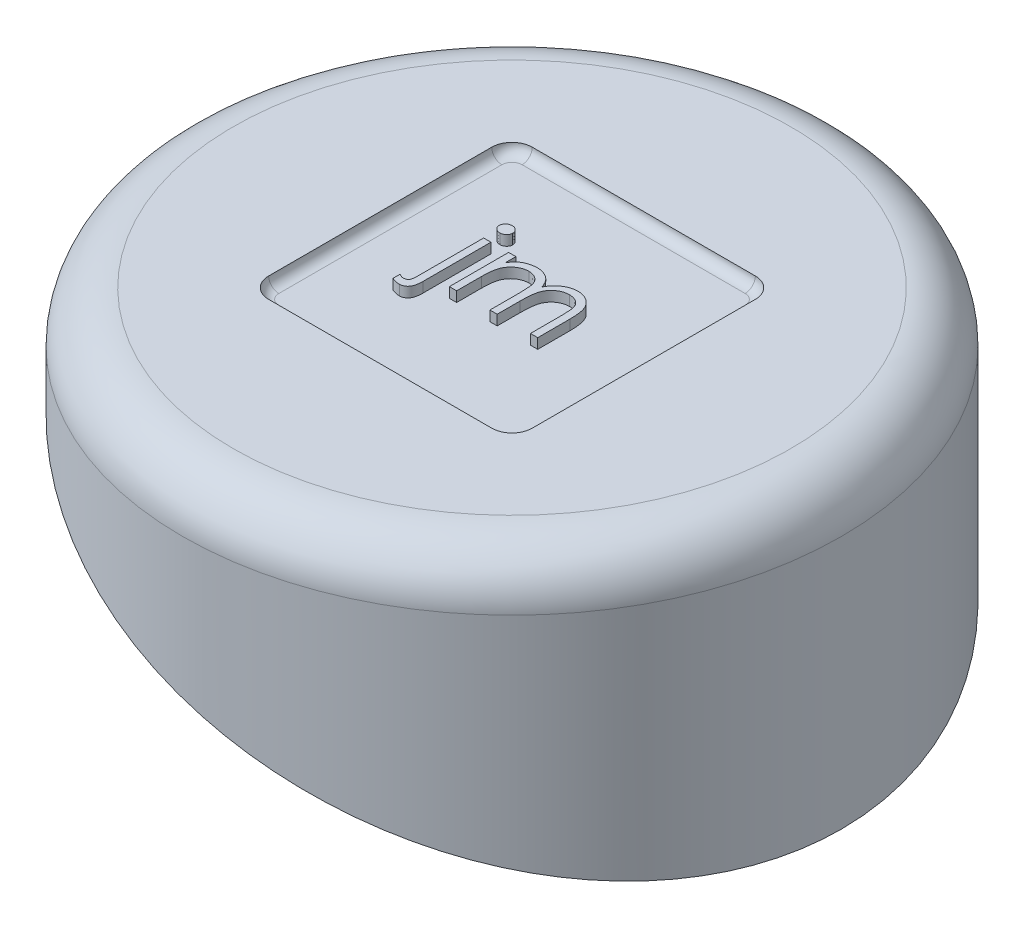
from build123d import *

# Parameters (mm, degrees)
SKETCH1_R                      = 32.5
BOSS_EXTRUDE1_DEPTH            = 30
CUT_EXTRUDE1_REACH             = 56.886
CUT_EXTRUDE1_DIRECTION_2_REACH = 56.886
FILLET1_R                      = 5
CUT_EXTRUDE2_DEPTH             = 1
FILLET3_R                      = 1


# Read off the part's stored shape, not the designer's step: Shell1
with BuildPart() as part:
    # Sketch1 → Boss-Extrude1 (new body)
    with BuildSketch(Plane(origin=(0, 0, 0), x_dir=(1, 0, 0), z_dir=(0, 1, 0))):
        with Locations(Location((0, 0, 0), (0, 0, 270))):
            Circle(SKETCH1_R)
    extrude(amount=BOSS_EXTRUDE1_DEPTH)

    # Sketch2 → Cut-Extrude1 (cut, up to next)
    with BuildSketch(Plane.XY, mode=Mode.PRIVATE) as cut_extrude1_sk1:
        Polygon((32.5, 0), (-32.5, 0), (-32.5, 22.381294864), align=None)
    cut_extrude1_tool1 = extrude(cut_extrude1_sk1.sketch, amount=-CUT_EXTRUDE1_REACH, mode=Mode.PRIVATE) & part.part
    add(cut_extrude1_tool1.solids().sort_by_distance((-10.833333, 7.460432, 0))[0], mode=Mode.SUBTRACT)

    # Sketch2 → Cut-Extrude1 direction 2 (cut, up to next)
    with BuildSketch(Plane.XY, mode=Mode.PRIVATE) as cut_extrude1_direction_2_sk1:
        Polygon((32.5, 0), (-32.5, 0), (-32.5, 22.381294864), align=None)
    cut_extrude1_direction_2_tool1 = extrude(cut_extrude1_direction_2_sk1.sketch, amount=CUT_EXTRUDE1_DIRECTION_2_REACH, mode=Mode.PRIVATE) & part.part
    add(cut_extrude1_direction_2_tool1.solids().sort_by_distance((-10.833333, 7.460432, 0))[0], mode=Mode.SUBTRACT)

    # Fillet1
    fillet1_edges = [part.edges().sort_by_distance(p)[0] for p in [
        (0, 30, -32.5),
    ]]
    fillet(fillet1_edges, radius=FILLET1_R)

    # Shell1 outline → Shell1 (revolve, cut)
    with BuildSketch(Plane.XY):
        with BuildLine():
            Line((30, 0.855474381), (30, 25))
            ThreePointArc((30, 25), (29.267766953, 26.767766953), (27.5, 27.5))
            Line((27.5, 27.5), (0, 27.5))
            Line((0, 27.5), (0, 0.855474381))
            Line((0, 0.855474381), (30, 0.855474381))
        make_face()
    revolve(axis=Axis((0, 0, 0), (0, 1, 0)), mode=Mode.SUBTRACT)

    # Sketch3 → Cut-Extrude2 (cut)
    with BuildSketch(Plane(origin=(0, 30, 0), x_dir=(1, 0, 0), z_dir=(0, 1, 0))):
        with BuildLine():
            Line((-11, -13), (11, -13))
            ThreePointArc((11, -13), (12.414213562, -12.414213562), (13, -11))
            Line((13, -11), (13, 11))
            ThreePointArc((13, 11), (12.414213562, 12.414213562), (11, 13))
            Line((11, 13), (-11, 13))
            ThreePointArc((-11, 13), (-12.414213562, 12.414213562), (-13, 11))
            Line((-13, 11), (-13, -11))
            ThreePointArc((-13, -11), (-12.414213562, -12.414213562), (-11, -13))
        make_face()
        with BuildLine():
            add(Edge.make_bspline(
                [(-5.282051282, 5.307692308), (-5.236975366, 5.305640925), (-5.149218681, 5.301647161), (-5.022802533, 5.267338194), (-4.909061876, 5.207587837), (-4.807209142, 5.129974539), (-4.721777304, 5.036046271), (-4.659757623, 4.929046076), (-4.623067759, 4.811615461), (-4.617980131, 4.730489807), (-4.615384615, 4.689102564)],
                knots=[0, 0, 0, 0, 1.06928763, 2.081757757, 3.080304056, 4.102817284, 5.108909582, 6.075019406, 7.017947647, 8, 8, 8, 8], degree=3))
            add(Edge.make_bspline(
                [(-4.615384615, 4.689102564), (-4.618030629, 4.648790576), (-4.623250749, 4.569262093), (-4.659730308, 4.453851407), (-4.722295343, 4.348351335), (-4.807151947, 4.254605589), (-4.90907689, 4.177036802), (-5.022798515, 4.117274713), (-5.149219758, 4.082968888), (-5.236975731, 4.078974685), (-5.282051282, 4.076923077)],
                knots=[0, 0, 0, 0, 0.962634111, 1.899108286, 2.860048811, 3.872254101, 4.900980094, 5.905593535, 6.924215405, 8, 8, 8, 8], degree=3))
            add(Edge.make_bspline(
                [(-5.282051282, 4.076923077), (-5.327126833, 4.078974685), (-5.414882807, 4.082968888), (-5.541304049, 4.117274713), (-5.655025674, 4.177036802), (-5.756950617, 4.254605589), (-5.841807221, 4.348351335), (-5.904372256, 4.453851407), (-5.940851815, 4.569262093), (-5.946071935, 4.648790576), (-5.948717949, 4.689102564)],
                knots=[0, 0, 0, 0, 1.075784595, 2.094406465, 3.099019906, 4.127745899, 5.139951189, 6.100891714, 7.037365889, 8, 8, 8, 8], degree=3))
            add(Edge.make_bspline(
                [(-5.948717949, 4.689102564), (-5.946122433, 4.730489807), (-5.941034805, 4.811615461), (-5.904344941, 4.929046076), (-5.84232526, 5.036046271), (-5.756893422, 5.129974539), (-5.655040688, 5.207587837), (-5.541300031, 5.267338194), (-5.414883883, 5.301647161), (-5.327127198, 5.305640925), (-5.282051282, 5.307692308)],
                knots=[0, 0, 0, 0, 0.982052353, 1.924980594, 2.891090418, 3.897182716, 4.919695944, 5.918242243, 6.93071237, 8, 8, 8, 8], degree=3))
        make_face(mode=Mode.SUBTRACT)
        with BuildLine():
            Line((-5.641025641, 2.846153846), (-4.923076923, 2.846153846))
            Line((-4.923076923, 2.846153846), (-4.923076923, -3.854166667))
            add(Edge.make_bspline(
                [(-4.923076923, -3.854166667), (-4.923306085, -3.9134959), (-4.92374644, -4.027502442), (-4.937853634, -4.192129944), (-4.956153699, -4.344763739), (-4.982838189, -4.485226726), (-5.018144966, -4.613403668), (-5.061487106, -4.728474639), (-5.110239651, -4.832873999), (-5.170616622, -4.922792881), (-5.236266238, -5.001707505), (-5.307762498, -5.069990372), (-5.38471384, -5.128500979), (-5.468928137, -5.17443688), (-5.557665381, -5.212539031), (-5.652827641, -5.237094733), (-5.753111759, -5.254357849), (-5.822036034, -5.255714655), (-5.857371795, -5.256410256)],
                knots=[0, 0, 0, 0, 1.493029139, 2.868991889, 4.156754484, 5.362105958, 6.464967428, 7.499106053, 8.455465818, 9.358121702, 10.217355437, 11.035397588, 11.842309395, 12.643033568, 13.444773531, 14.266895717, 15.11148054, 16, 16, 16, 16], degree=3))
            add(Edge.make_bspline(
                [(-5.857371795, -5.256410256), (-5.919503866, -5.25426354), (-6.047915131, -5.249826819), (-6.245119458, -5.211028318), (-6.453856567, -5.154014571), (-6.59390963, -5.100115663), (-6.666666667, -5.072115385)],
                knots=[0, 0, 0, 0, 0.892368802, 1.844300437, 2.88012224, 4, 4, 4, 4], degree=3))
            Line((-6.666666667, -5.072115385), (-6.666666667, -4.381410256))
            add(Edge.make_bspline(
                [(-6.666666667, -4.381410256), (-6.621269973, -4.405620615), (-6.534648133, -4.45181662), (-6.402078767, -4.498579162), (-6.277898955, -4.532843954), (-6.196252149, -4.536639293), (-6.157051282, -4.538461538)],
                knots=[0, 0, 0, 0, 1.144578483, 2.183980519, 3.128079311, 4, 4, 4, 4], degree=3))
            add(Edge.make_bspline(
                [(-6.157051282, -4.538461538), (-6.111728271, -4.535550781), (-6.024320372, -4.529937226), (-5.902440887, -4.481495192), (-5.799697424, -4.399275874), (-5.752282332, -4.325381348), (-5.727564103, -4.286858974)],
                knots=[0, 0, 0, 0, 1.036054724, 1.998088038, 2.956371939, 4, 4, 4, 4], degree=3))
            add(Edge.make_bspline(
                [(-5.727564103, -4.286858974), (-5.713528983, -4.253032533), (-5.680686851, -4.173878778), (-5.658252882, -4.025781528), (-5.642515867, -3.837488752), (-5.641553677, -3.697187626), (-5.641025641, -3.620192308)],
                knots=[0, 0, 0, 0, 0.647276487, 1.514624746, 2.636060416, 4, 4, 4, 4], degree=3))
            Line((-5.641025641, -3.620192308), (-5.641025641, 2.846153846))
        make_face(mode=Mode.SUBTRACT)
        with BuildLine():
            Line((-3.179487179, 2.846153846), (-2.461538462, 2.846153846))
            Line((-2.461538462, 2.846153846), (-2.461538462, 1.830128205))
            add(Edge.make_bspline(
                [(-2.461538462, 1.830128205), (-2.396889433, 1.919014152), (-2.273015697, 2.089328148), (-2.069894205, 2.313763083), (-1.866977377, 2.504227436), (-1.720843933, 2.604211143), (-1.650641026, 2.65224359)],
                knots=[0, 0, 0, 0, 1.134379233, 2.173579362, 3.122582517, 4, 4, 4, 4], degree=3))
            add(Edge.make_bspline(
                [(-1.650641026, 2.65224359), (-1.554950369, 2.697970139), (-1.365240884, 2.788624341), (-1.064854084, 2.880586761), (-0.757483411, 2.937101279), (-0.549921779, 2.944830132), (-0.445512821, 2.948717949)],
                knots=[0, 0, 0, 0, 1.014936303, 2.012140481, 3.000054389, 4, 4, 4, 4], degree=3))
            add(Edge.make_bspline(
                [(-0.445512821, 2.948717949), (-0.374900257, 2.946328713), (-0.235161791, 2.941600543), (-0.028112442, 2.910834748), (0.172707242, 2.857654924), (0.366110738, 2.783581041), (0.548329434, 2.693874328), (0.715390457, 2.588617853), (0.865388647, 2.470453109), (0.998248193, 2.334044119), (1.117720251, 2.175560465), (1.227614758, 1.990727897), (1.3291581, 1.7753961), (1.385435377, 1.61912972), (1.415064103, 1.536858974)],
                knots=[0, 0, 0, 0, 1.009824226, 1.998387844, 2.986035974, 3.974953746, 4.955485308, 5.885931332, 6.793869504, 7.679848016, 8.601185859, 9.625726857, 10.749998409, 12, 12, 12, 12], degree=3))
            add(Edge.make_bspline(
                [(1.415064103, 1.536858974), (1.446404106, 1.593371933), (1.508076831, 1.704581498), (1.611632572, 1.861971812), (1.720130393, 2.009187336), (1.834494948, 2.146344878), (1.954322576, 2.272767119), (2.080177205, 2.388872037), (2.211342419, 2.495158239), (2.393724682, 2.619325461), (2.631010642, 2.751213876), (2.930183475, 2.865564605), (3.241383868, 2.936230041), (3.452624321, 2.944527808), (3.559294872, 2.948717949)],
                knots=[0, 0, 0, 0, 0.86119277, 1.694706429, 2.50939023, 3.298075842, 4.073795165, 4.829715201, 5.57930267, 6.321991688, 7.768977793, 9.186738141, 10.579381044, 12, 12, 12, 12], degree=3))
            add(Edge.make_bspline(
                [(3.559294872, 2.948717949), (3.657309644, 2.945021444), (3.84913407, 2.937787025), (4.128396391, 2.880979086), (4.388834803, 2.783430178), (4.629925263, 2.650324723), (4.847433408, 2.483058019), (5.036499258, 2.284043533), (5.195974374, 2.054688966), (5.300154122, 1.838935849), (5.370817583, 1.648455088), (5.414386118, 1.486154994), (5.45287685, 1.307522873), (5.484833982, 1.112345132), (5.508190673, 0.899932313), (5.525495165, 0.670632025), (5.537207333, 0.424266056), (5.538034927, 0.25428777), (5.538461538, 0.166666667)],
                knots=[0, 0, 0, 0, 1.209669288, 2.367440248, 3.500751976, 4.631527125, 5.755587489, 6.87532382, 8.007944318, 9.190864318, 9.82315674, 10.514484317, 11.263564316, 12.079023757, 12.955305781, 13.901327259, 14.918167583, 16, 16, 16, 16], degree=3))
            Line((5.538461538, 0.166666667), (5.538461538, -3))
            Line((5.538461538, -3), (4.820512821, -3))
            Line((4.820512821, -3), (4.820512821, 0.169871795))
            add(Edge.make_bspline(
                [(4.820512821, 0.169871795), (4.820334802, 0.244661678), (4.819992678, 0.38839646), (4.813835806, 0.594687777), (4.802235088, 0.782729736), (4.7886702, 0.952265937), (4.769827207, 1.10369174), (4.745493649, 1.236702982), (4.719716095, 1.35234598), (4.676890972, 1.48054266), (4.608438648, 1.621960284), (4.504170123, 1.774471314), (4.37280988, 1.907227429), (4.221129522, 2.022469296), (4.048447362, 2.116169047), (3.858127995, 2.183085641), (3.65135302, 2.224509363), (3.508215218, 2.228637398), (3.434294872, 2.230769231)],
                knots=[0, 0, 0, 0, 1.253487763, 2.409012846, 3.458416907, 4.410876679, 5.259312806, 6.014470957, 6.676830364, 7.243083969, 8.276244668, 9.299465089, 10.325150304, 11.392391894, 12.482080715, 13.603491619, 14.762376348, 16, 16, 16, 16], degree=3))
            add(Edge.make_bspline(
                [(3.434294872, 2.230769231), (3.34362069, 2.2275323), (3.164414036, 2.221134893), (2.902824353, 2.155823183), (2.65146203, 2.057354039), (2.41782744, 1.91465128), (2.202906776, 1.743660734), (2.017993455, 1.540347372), (1.865234174, 1.310336111), (1.761796515, 1.097429362), (1.69644954, 0.906184919), (1.653302304, 0.739105212), (1.619740267, 0.549204485), (1.588264771, 0.337758792), (1.567721393, 0.103312666), (1.549050828, -0.153049394), (1.540317427, -0.432098444), (1.539095807, -0.625530875), (1.538461538, -0.725961538)],
                knots=[0, 0, 0, 0, 1.090531906, 2.155305635, 3.229839962, 4.33261226, 5.44038871, 6.529323825, 7.629011124, 8.757537029, 9.370236727, 10.061839251, 10.834451254, 11.692844982, 12.636905849, 13.66920014, 14.789842145, 16, 16, 16, 16], degree=3))
            Line((1.538461538, -0.725961538), (1.538461538, -3))
            Line((1.538461538, -3), (0.820512821, -3))
            Line((0.820512821, -3), (0.820512821, -0.02724359))
            add(Edge.make_bspline(
                [(0.820512821, -0.02724359), (0.820331264, 0.056626853), (0.819981968, 0.217985155), (0.813864671, 0.449376413), (0.802238107, 0.659847453), (0.788796853, 0.849153656), (0.769459303, 1.016950979), (0.747494132, 1.164138998), (0.721554451, 1.290348714), (0.678606143, 1.428779308), (0.612973073, 1.581284275), (0.507399903, 1.743892324), (0.375725433, 1.886219404), (0.221277717, 2.007725114), (0.047550443, 2.108162786), (-0.144411616, 2.180527933), (-0.352879988, 2.222640595), (-0.496600459, 2.228008587), (-0.570512821, 2.230769231)],
                knots=[0, 0, 0, 0, 1.320475261, 2.540461679, 3.643808994, 4.639130445, 5.527981419, 6.302341397, 6.981980563, 7.553956391, 8.582137848, 9.585246428, 10.591171744, 11.620968678, 12.668337649, 13.738356861, 14.836885341, 16, 16, 16, 16], degree=3))
            add(Edge.make_bspline(
                [(-0.570512821, 2.230769231), (-0.657407018, 2.227271036), (-0.830584068, 2.220299259), (-1.08498857, 2.157546633), (-1.330670133, 2.059251605), (-1.563709444, 1.922886305), (-1.777821783, 1.753974125), (-1.965269251, 1.555311506), (-2.122852167, 1.329370858), (-2.22738203, 1.118709106), (-2.294807113, 0.932255906), (-2.33959645, 0.773739454), (-2.378087023, 0.597738887), (-2.406690501, 0.403711204), (-2.43430288, 0.192920132), (-2.4476293, -0.035684416), (-2.460592871, -0.281906331), (-2.461215533, -0.45190072), (-2.461538462, -0.540064103)],
                knots=[0, 0, 0, 0, 1.098833095, 2.189935336, 3.297829714, 4.440610912, 5.596351641, 6.740013378, 7.886572111, 9.072425424, 9.705826452, 10.395263256, 11.156850408, 11.985370555, 12.878090359, 13.847760091, 14.883794034, 16, 16, 16, 16], degree=3))
            Line((-2.461538462, -0.540064103), (-2.461538462, -3))
            Line((-2.461538462, -3), (-3.179487179, -3))
            Line((-3.179487179, -3), (-3.179487179, 2.846153846))
        make_face(mode=Mode.SUBTRACT)
    extrude(amount=-CUT_EXTRUDE2_DEPTH, mode=Mode.SUBTRACT)

    # Fillet3
    fillet3_edges = [part.edges().sort_by_distance(p)[0] for p in [
        (0, 29, -13),
        (12.414213562, 29, -12.414213562),
        (13, 29, 0),
        (12.414213562, 29, 12.414213562),
        (0, 29, 13),
        (-12.414213562, 29, 12.414213562),
        (-13, 29, 0),
        (-12.414213562, 29, -12.414213562),
    ]]
    fillet(fillet3_edges, radius=FILLET3_R - 0.0001)  # a hair under: the kernel refuses the full size


solid = part.part
